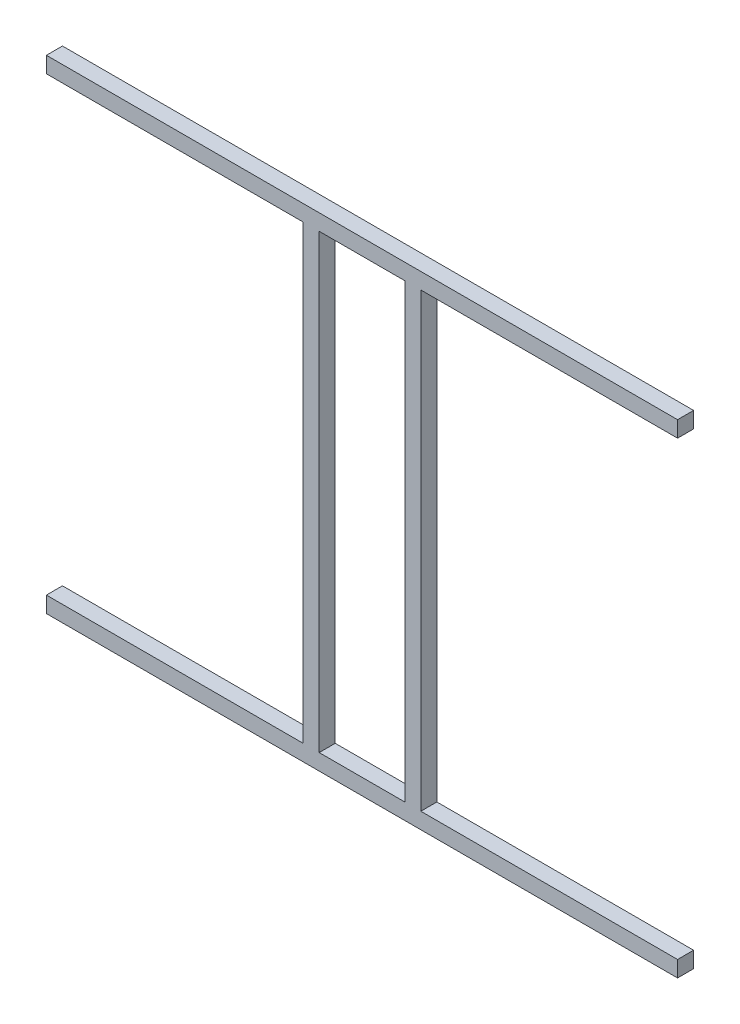
from build123d import *

# Parameters (mm, degrees)
SKETCH1_W          = 110
SKETCH1_H          = 15
EXTRUDE1_DEPTH     = 5
EXTRUDE1_2_DEPTH   = 5
SKETCH2_W          = 80
SKETCH2_H          = 421.99984649
EXTRUDE2_DEPTH     = 15
SKETCH3_W          = 396.939952582
SKETCH3_H          = 356.629376549
CUT_EXTRUDE1_DEPTH = 10


with BuildPart() as part:
    # Sketch1 → Extrude1 (new body)
    with BuildSketch(Plane.XY):
        with Locations((0, 93.499923245)):
            Rectangle(SKETCH1_W, SKETCH1_H)
    extrude(amount=EXTRUDE1_DEPTH)



with BuildPart() as body_2:
    # Sketch1 → Extrude1 2 (new body)
    with BuildSketch(Plane.XY):
        with Locations((0, -93.499923245)):
            Rectangle(SKETCH1_W, SKETCH1_H)
    extrude(amount=EXTRUDE1_2_DEPTH)


with BuildPart() as part_1:
    add(part.part)

    add(body_2.part)  # Extrude2 merges body 2
    # Sketch2 → Extrude2 (add)
    with BuildSketch(Plane.XY.offset(5)):
        Polygon((55, -210.999923245), (55, 210.999923245), (295, 210.999923245), (295, 225.999923245), (-295, 225.999923245), (-295, 210.999923245), (-55, 210.999923245), (-55, -210.999923245), (-295, -210.999923245), (-295, -225.999923245), (295, -225.999923245), (295, -210.999923245), align=None)
        Rectangle(SKETCH2_W, SKETCH2_H, mode=Mode.SUBTRACT)
    extrude(amount=EXTRUDE2_DEPTH)

    # Sketch3 → Cut-Extrude1 (cut)
    with BuildSketch(Plane(origin=(0, 0, 5), x_dir=(-1, 0, 0), z_dir=(0, 0, -1))):
        with Locations((4.889095415, 38.776340626)):
            Rectangle(SKETCH3_W, SKETCH3_H)
    extrude(amount=CUT_EXTRUDE1_DEPTH, mode=Mode.SUBTRACT)


solid = part_1.part
